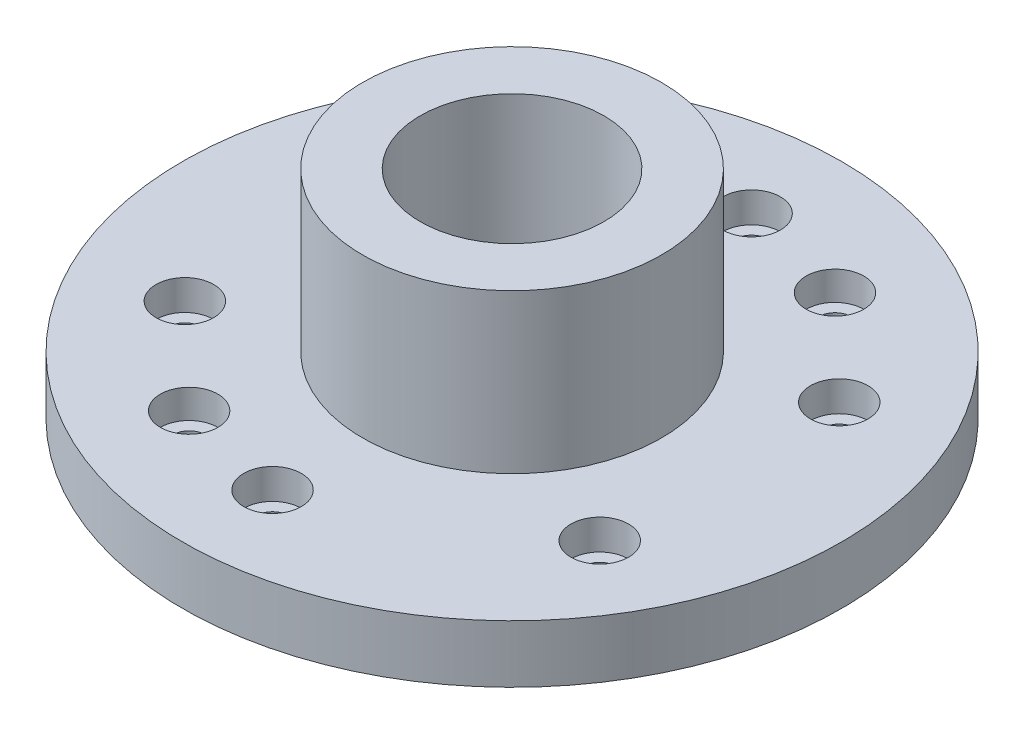
from build123d import *

# Parameters (mm, degrees)
CBORE_FOR_M4_SHCS3_D           = 4.5
CBORE_FOR_M4_SHCS3_CBORE_D     = 8
CBORE_FOR_M4_SHCS3_CBORE_DEPTH = 4.2
CBORE_FOR_M4_SHCS4_D           = 4.5
CBORE_FOR_M4_SHCS4_CBORE_D     = 8
CBORE_FOR_M4_SHCS4_CBORE_DEPTH = 4


with BuildPart() as part:
    # Sketch1 → Revolve1 (revolve)
    with BuildSketch(Plane(origin=(0, 0, 0), x_dir=(0, 0, -1), z_dir=(1, 0, 0))):
        Polygon((-12.75, 0), (-45.75, 0), (-45.75, 8), (-20.75, 8), (-20.75, 30), (-12.75, 30), align=None)
    revolve(axis=Axis((0, -55, 0), (0, 1, 0)))

    # CBORE for M4 SHCS3 (through all)
    with Locations(Plane(origin=(0, 8, 0), x_dir=(1, 0, 0), z_dir=(0, 1, 0))):
        with Locations((0, 33.25), (28.795344676, 16.625), (28.795344676, -16.625), (0, -33.25), (-28.795344676, -16.625), (-28.795344676, 16.625)):
            CounterBoreHole(CBORE_FOR_M4_SHCS3_D / 2, CBORE_FOR_M4_SHCS3_CBORE_D / 2, CBORE_FOR_M4_SHCS3_CBORE_DEPTH)

    # CBORE for M4 SHCS4 (through all)
    with Locations(Plane(origin=(0, 8, 0), x_dir=(1, 0, 0), z_dir=(0, 1, 0))):
        with Locations((15.313173529, 29.513881759), (-15.313173529, -29.513881759)):
            CounterBoreHole(CBORE_FOR_M4_SHCS4_D / 2, CBORE_FOR_M4_SHCS4_CBORE_D / 2, CBORE_FOR_M4_SHCS4_CBORE_DEPTH)


solid = part.part
